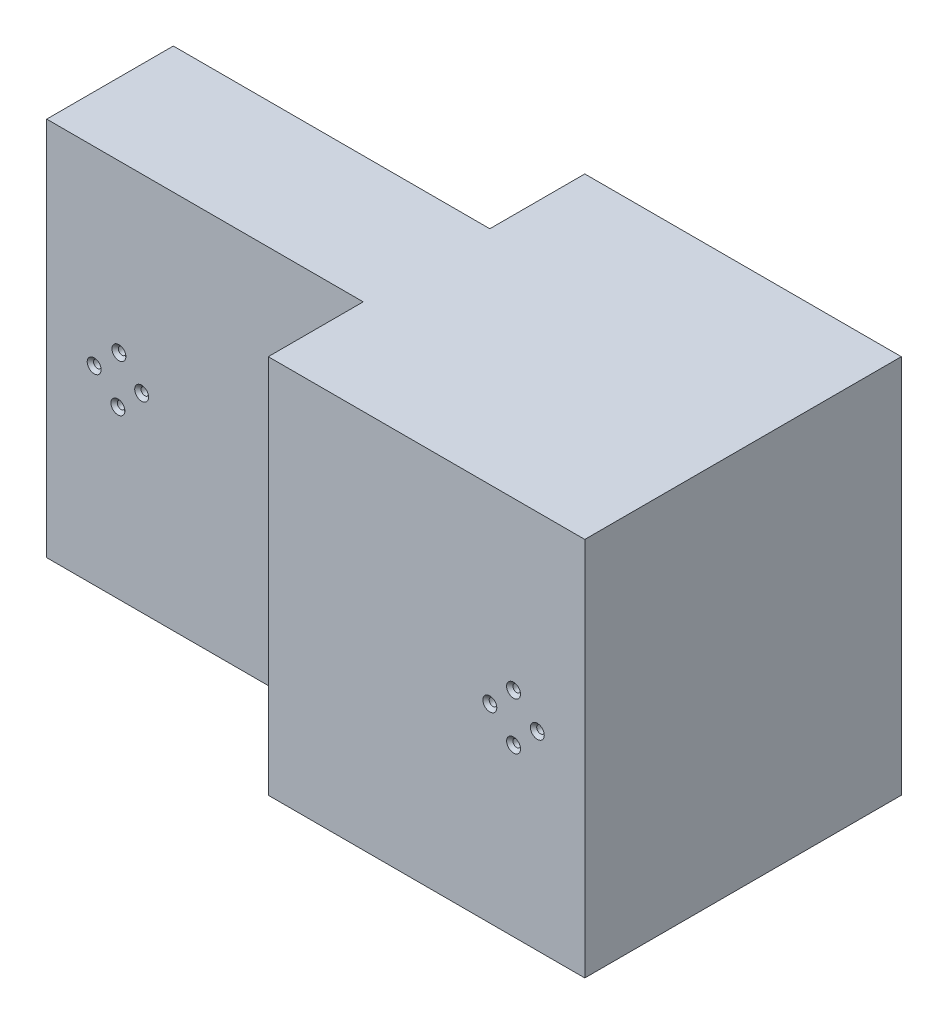
from build123d import *

# Parameters (mm, degrees)
SKETCH3_W                                       = 200
SKETCH3_H                                       = 100
BOSS_EXTRUDE2_DEPTH                             = 120
SKETCH4_W                                       = 100
SKETCH4_H                                       = 120
CUT_EXTRUDE1_DEPTH                              = 30
SKETCH5_W                                       = 100
SKETCH5_H                                       = 120
CUT_EXTRUDE2_DEPTH                              = 30
SHELL1_START                                    = 10
SHELL1_OUTLINE_W                                = 100
SHELL1_OUTLINE_H                                = 80
SHELL1_DEPTH                                    = 80
SHELL1_START_2                                  = -90
SHELL1_2_OUTLINE_W                              = 100
SHELL1_2_OUTLINE_H                              = 20
SHELL1_2_DEPTH                                  = 100
CSK_FOR_M2_FLAT_HEAD_MACHINE_SCREW1_D           = 2.4
CSK_FOR_M2_FLAT_HEAD_MACHINE_SCREW1_DEPTH       = 15
CSK_FOR_M2_FLAT_HEAD_MACHINE_SCREW1_CSINK_D     = 4.4
CSK_FOR_M2_FLAT_HEAD_MACHINE_SCREW1_CSINK_ANGLE = 90
CSK_FOR_M2_FLAT_HEAD_MACHINE_SCREW1_TIP         = 0.721032743
CSK_FOR_M2_FLAT_HEAD_MACHINE_SCREW2_D           = 2.4
CSK_FOR_M2_FLAT_HEAD_MACHINE_SCREW2_DEPTH       = 15
CSK_FOR_M2_FLAT_HEAD_MACHINE_SCREW2_CSINK_D     = 4.4
CSK_FOR_M2_FLAT_HEAD_MACHINE_SCREW2_CSINK_ANGLE = 90
CSK_FOR_M2_FLAT_HEAD_MACHINE_SCREW2_TIP         = 0.721032743


# Read off the part's stored shape, not the designer's step: Shell1
with BuildPart() as part:
    # Sketch3 → Boss-Extrude2 (new body)
    with BuildSketch(Plane(origin=(0, 0, 0), x_dir=(1, 0, 0), z_dir=(0, 1, 0))):
        Rectangle(SKETCH3_W, SKETCH3_H)
    extrude(amount=BOSS_EXTRUDE2_DEPTH)

    # Sketch4 → Cut-Extrude1 (cut)
    with BuildSketch(Plane.XY.offset(50)):
        with Locations((-50, 60)):
            Rectangle(SKETCH4_W, SKETCH4_H)
    extrude(amount=-CUT_EXTRUDE1_DEPTH, mode=Mode.SUBTRACT)

    # Sketch5 → Cut-Extrude2 (cut)
    with BuildSketch(Plane(origin=(0, 0, -50), x_dir=(-1, 0, 0), z_dir=(0, 0, -1))):
        with Locations((50, 60)):
            Rectangle(SKETCH5_W, SKETCH5_H)
    extrude(amount=-CUT_EXTRUDE2_DEPTH, mode=Mode.SUBTRACT)

    # Shell1 outline → Shell1 (cut)
    with BuildSketch(Plane.YZ.offset(SHELL1_START)):
        with Locations((60, 0)):
            Rectangle(SHELL1_OUTLINE_W, SHELL1_OUTLINE_H)
    extrude(amount=SHELL1_DEPTH, mode=Mode.SUBTRACT)

    # Shell1 2 outline → Shell1 2 (cut)
    with BuildSketch(Plane.YZ.offset(SHELL1_START_2)):
        with Locations((60, 0)):
            Rectangle(SHELL1_2_OUTLINE_W, SHELL1_2_OUTLINE_H)
    extrude(amount=SHELL1_2_DEPTH, mode=Mode.SUBTRACT)

    # CSK for M2 Flat Head Machine Screw1
    with Locations(Plane.XY.offset(50)):
        with Locations((85, 60), (70, 60), (77.5, 67.5), (77.5, 52.5)):
            CounterSinkHole(CSK_FOR_M2_FLAT_HEAD_MACHINE_SCREW1_D / 2, CSK_FOR_M2_FLAT_HEAD_MACHINE_SCREW1_CSINK_D / 2, depth=CSK_FOR_M2_FLAT_HEAD_MACHINE_SCREW1_DEPTH, counter_sink_angle=CSK_FOR_M2_FLAT_HEAD_MACHINE_SCREW1_CSINK_ANGLE)
            with Locations((0, 0, -(CSK_FOR_M2_FLAT_HEAD_MACHINE_SCREW1_DEPTH + CSK_FOR_M2_FLAT_HEAD_MACHINE_SCREW1_TIP / 2))):  # 118° drill point
                Cone(0, CSK_FOR_M2_FLAT_HEAD_MACHINE_SCREW1_D / 2, CSK_FOR_M2_FLAT_HEAD_MACHINE_SCREW1_TIP, mode=Mode.SUBTRACT)

    # CSK for M2 Flat Head Machine Screw2
    with Locations(Plane.XY.offset(20)):
        with Locations((-85, 60), (-77.179261413, 67.5), (-70, 60), (-77.5, 52.5034295)):
            CounterSinkHole(CSK_FOR_M2_FLAT_HEAD_MACHINE_SCREW2_D / 2, CSK_FOR_M2_FLAT_HEAD_MACHINE_SCREW2_CSINK_D / 2, depth=CSK_FOR_M2_FLAT_HEAD_MACHINE_SCREW2_DEPTH, counter_sink_angle=CSK_FOR_M2_FLAT_HEAD_MACHINE_SCREW2_CSINK_ANGLE)
            with Locations((0, 0, -(CSK_FOR_M2_FLAT_HEAD_MACHINE_SCREW2_DEPTH + CSK_FOR_M2_FLAT_HEAD_MACHINE_SCREW2_TIP / 2))):  # 118° drill point
                Cone(0, CSK_FOR_M2_FLAT_HEAD_MACHINE_SCREW2_D / 2, CSK_FOR_M2_FLAT_HEAD_MACHINE_SCREW2_TIP, mode=Mode.SUBTRACT)


solid = part.part
